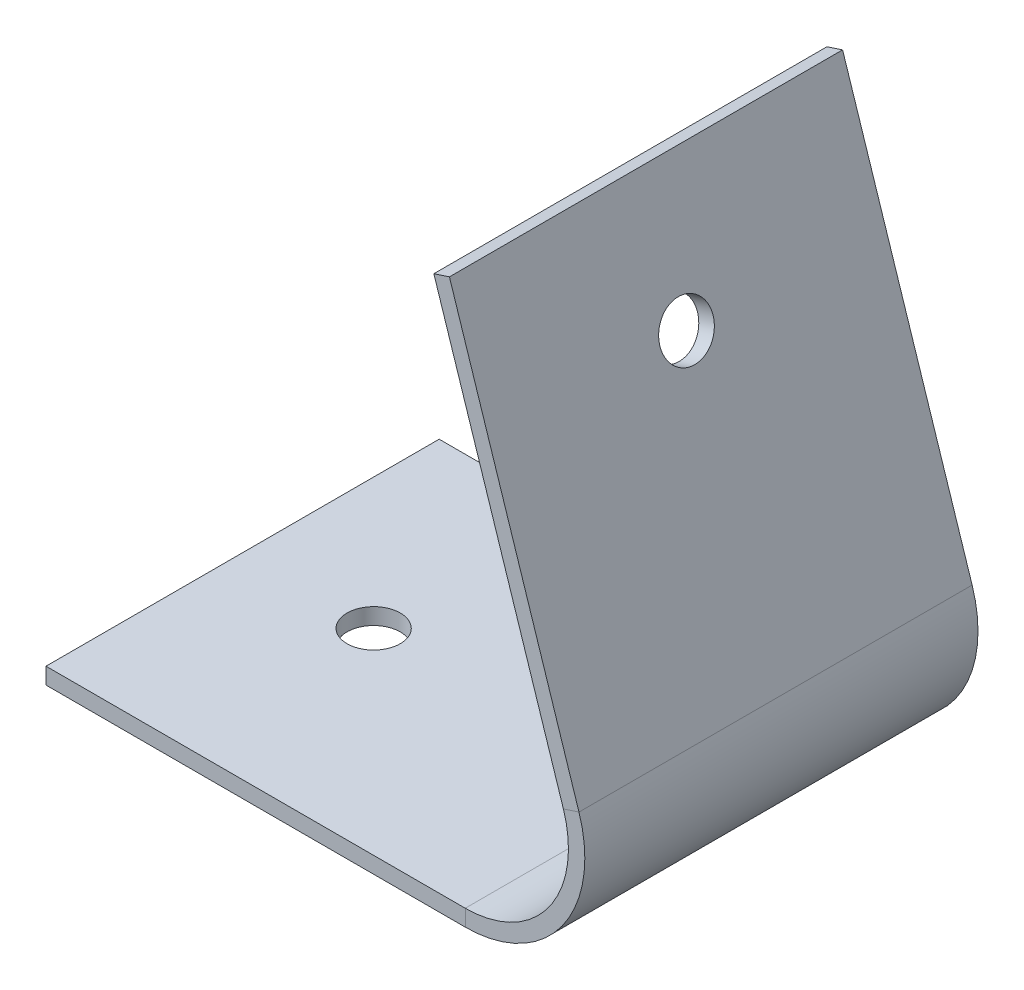
from build123d import *

# Parameters (mm, degrees)
SKETCH1_W                  = 101.6
SKETCH1_H                  = 38.1
SKETCH1_R                  = 2.5796875
BOSS_EXTRUDE1_DEPTH        = 1.5875
SKETCHED_START             = -19.05
SKETCHED_BEND1_DEPTH       = 38.1
SKETCHED_BEND1_2_DEPTH     = 16.4703124
SKETCHED_START_2           = 2.5796876
SKETCHED_BEND1_3_DEPTH     = 16.4703124
SKETCHED_START_3           = -2.5796876
SKETCHED_BEND1_4_DEPTH     = 5.1593752
SKETCHED_START_4           = 3.905760394
SKETCHED_BEND1_5_OUTLINE_R = 2.5796875
SKETCHED_BEND1_5_DEPTH     = 1.5875


with BuildPart() as part:
    # Sketch1 → Boss-Extrude1 (new body)
    with BuildSketch(Plane(origin=(0, 0, 0), x_dir=(1, 0, 0), z_dir=(0, 1, 0))):
        Rectangle(SKETCH1_W, SKETCH1_H)
        with Locations(Location((-38.1, 0, 0), (0, 0, 270))):
            Circle(SKETCH1_R, mode=Mode.SUBTRACT)
        with Locations(Location((38.1, 0, 0), (0, 0, 270))):
            Circle(SKETCH1_R, mode=Mode.SUBTRACT)
    extrude(amount=BOSS_EXTRUDE1_DEPTH)

    # Sketched Bend1: read off the stored shape, not the designer's step
    # Sketched Bend1 outline → Sketched Bend1 (cut)
    with BuildSketch(Plane.XY.offset(SKETCHED_START)):
        with BuildLine():
            Line((50.8, 1.5875), (-4.318797944, 1.5875))
            ThreePointArc((-4.318797944, 1.5875), (-7.140118794, 0.403914791), (-10.172869711, 0))
            Line((-10.172869711, 0), (50.8, 0))
            Line((50.8, 0), (50.8, 1.5875))
        make_face()
    extrude(amount=SKETCHED_BEND1_DEPTH, mode=Mode.SUBTRACT)

    # Sketched Bend1 2 outline → Sketched Bend1 2 (add)
    with BuildSketch(Plane.XY.offset(SKETCHED_START)):
        with BuildLine():
            Line((-13.21677824, 53.316366943), (-0.662304548, 14.677669944))
            ThreePointArc((-0.662304548, 14.677669944), (-2.082699768, 5.709647478), (-10.172869711, 1.5875))
            Line((-10.172869711, 1.5875), (-4.318797944, 1.5875))
            ThreePointArc((-4.318797944, 1.5875), (0.657447044, 7.467500578), (0.847497671, 15.168234422))
            Line((0.847497671, 15.168234422), (-11.706976021, 53.806931422))
            Line((-11.706976021, 53.806931422), (-13.21677824, 53.316366943))
        make_face()
    extrude(amount=SKETCHED_BEND1_2_DEPTH)

    # Sketched Bend1 3 outline → Sketched Bend1 3 (add)
    with BuildSketch(Plane.XY.offset(SKETCHED_START_2)):
        with BuildLine():
            Line((-13.21677824, 53.316366943), (-0.662304548, 14.677669944))
            ThreePointArc((-0.662304548, 14.677669944), (-2.082699768, 5.709647478), (-10.172869711, 1.5875))
            Line((-10.172869711, 1.5875), (-4.318797944, 1.5875))
            ThreePointArc((-4.318797944, 1.5875), (0.657447044, 7.467500578), (0.847497671, 15.168234422))
            Line((0.847497671, 15.168234422), (-11.706976021, 53.806931422))
            Line((-11.706976021, 53.806931422), (-13.21677824, 53.316366943))
        make_face()
    extrude(amount=SKETCHED_BEND1_3_DEPTH)

    # Sketched Bend1 4 outline → Sketched Bend1 4 (add)
    with BuildSketch(Plane.XY.offset(SKETCHED_START_3)):
        with BuildLine():
            Line((-13.21677824, 53.316366943), (-0.662304548, 14.677669944))
            ThreePointArc((-0.662304548, 14.677669944), (-2.082699768, 5.709647478), (-10.172869711, 1.5875))
            Line((-10.172869711, 1.5875), (-4.318797944, 1.5875))
            ThreePointArc((-4.318797944, 1.5875), (0.657447044, 7.467500578), (0.847497671, 15.168234422))
            Line((0.847497671, 15.168234422), (-11.706976021, 53.806931422))
            Line((-11.706976021, 53.806931422), (-13.21677824, 53.316366943))
        make_face()
    extrude(amount=SKETCHED_BEND1_4_DEPTH)

    # Sketched Bend1 5 outline → Sketched Bend1 5 (cut)
    with BuildSketch(Plane(origin=(0, 0, 0), x_dir=(-0.30901699437495117, 0.9510565162951524, 0), z_dir=(0.9510565162951524, 0.3090169943749511, 0)).offset(SKETCHED_START_4)):
        with Locations((42.091087294, 0)):
            Circle(SKETCHED_BEND1_5_OUTLINE_R)
    extrude(amount=SKETCHED_BEND1_5_DEPTH, mode=Mode.SUBTRACT)


solid = part.part
